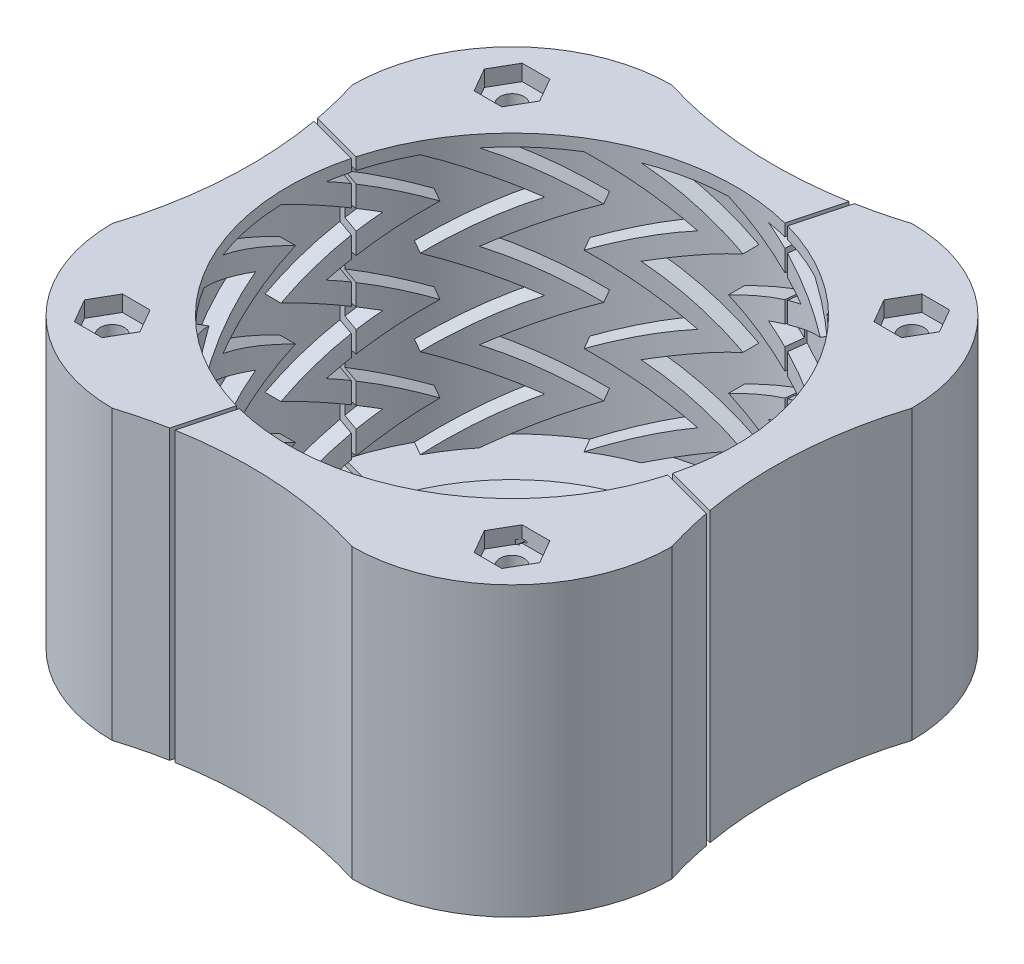
from build123d import *

# Parameters (mm, degrees)
SKETCH_2_W               = 70
SKETCH_2_H               = 70
EXTRUDE_1_DEPTH          = 36
FILLET_1_R               = 20
CUT_EXTRUDE_3_DEPTH      = 8
PATTERN_CIRCULAR_1_COUNT = 12
SKETCH_8_W               = 2
SKETCH_8_H               = 32.5
SKETCH_17_R              = 1.5
CUT_EXTRUDE_12_DEPTH     = 62.204574992
CUT_EXTRUDE_13_DEPTH     = 2
CUT_EXTRUDE_15_DEPTH     = 2
CUT_EXTRUDE_16_DEPTH     = 62.204574992
CUT_EXTRUDE_17_DEPTH     = 62.204574992


with BuildPart() as part:
    # Эскиз2 → Бобышка-Вытянуть1 (new body)
    with BuildSketch(Plane(origin=(0, 0, 0), x_dir=(1, 0, 0), z_dir=(0, 1, 0))):
        Rectangle(SKETCH_2_W, SKETCH_2_H)
    extrude(amount=EXTRUDE_1_DEPTH)

    # Эскиз3 → Вырез-Повернуть1 (revolve, cut)
    with BuildSketch(Plane(origin=(0, 0, 0), x_dir=(0, 0, -1), z_dir=(1, 0, 0))):
        Polygon((0, 36), (-28, 36), (-28, 2), (-23, 2), (-21, 0), (0, 0), align=None)
    revolve(axis=Axis((0, 0, 0), (0, 1, 0)), mode=Mode.SUBTRACT)

    # Скругление1
    fillet_1_edges = [part.edges().sort_by_distance(p)[0] for p in [
        (-35, 18, 35),
        (-35, 18, -35),
        (35, 18, -35),
        (35, 18, 35),
    ]]
    fillet(fillet_1_edges, radius=FILLET_1_R)

    # Эскиз7 → Вырез-Вытянуть3 (cut)
    with BuildSketch(Plane(origin=(23, 0, 0), x_dir=(0, 0, -1), z_dir=(1, 0, 0))):
        Polygon((10, 34.5), (0.899322945, 34.5), (-10, 29.166666667), (0.899322945, 23.833333333), (-10, 18.5), (0.899322945, 13.166666667), (-10, 7.833333333), (0.899322945, 2), (10, 2), (-0.899322945, 7.833333333), (10, 13.166666667), (-0.899322945, 18.5), (10, 23.833333333), (-0.899322945, 29.166666667), align=None)
    cut_extrude_3 = extrude(amount=CUT_EXTRUDE_3_DEPTH, mode=Mode.SUBTRACT)

    # Круговой массив1: Вырез-Вытянуть3 ×12 about axis
    pattern_circular_1_axis = Axis((0, 2, 0), (0, -1, 0))
    for i in range(1, PATTERN_CIRCULAR_1_COUNT):
        add(cut_extrude_3.rotate(pattern_circular_1_axis, i * 360 / PATTERN_CIRCULAR_1_COUNT), mode=Mode.SUBTRACT)

    # Эскиз8 → Повернуть1 (revolve)
    with BuildSketch(Plane(origin=(0, 0, 0), x_dir=(0, 0, -1), z_dir=(1, 0, 0))):
        with Locations((-31, 18.25)):
            Rectangle(SKETCH_8_W, SKETCH_8_H)
    revolve(axis=Axis((0, 47.507626588, 0), (0, -1, 0)))

    # Эскиз17 → Вырез-Вытянуть12 (cut, through all)
    with BuildSketch(Plane(origin=(0, 0, 0), x_dir=(1, 0, 0), z_dir=(0, 1, 0))):
        with Locations((-25, 25)):
            Circle(SKETCH_17_R)
        with Locations((25, 25)):
            Circle(SKETCH_17_R)
        with Locations((25, -25)):
            Circle(SKETCH_17_R)
        with Locations((-25, -25)):
            Circle(SKETCH_17_R)
    extrude(amount=CUT_EXTRUDE_12_DEPTH, mode=Mode.SUBTRACT)

    # Эскиз18 → Вырез-Вытянуть13 (cut)
    with BuildSketch(Plane(origin=(0, 36, 0), x_dir=(1, 0, 0), z_dir=(0, 1, 0))):
        Polygon((-26.732050808, 28), (-28.464101615, 25), (-26.732050808, 22), (-23.267949192, 22), (-21.535898385, 25), (-23.267949192, 28), align=None)
        Polygon((23.267949192, 28), (21.535898385, 25), (23.267949192, 22), (26.732050808, 22), (28.464101615, 25), (26.732050808, 28), align=None)
        Polygon((23.267949192, -22), (21.535898385, -25), (23.267949192, -28), (26.732050808, -28), (28.464101615, -25), (26.732050808, -22), align=None)
        Polygon((-26.732050808, -22), (-28.464101615, -25), (-26.732050808, -28), (-23.267949192, -28), (-21.535898385, -25), (-23.267949192, -22), align=None)
    extrude(amount=-CUT_EXTRUDE_13_DEPTH, mode=Mode.SUBTRACT)

    # Эскиз19 → Вырез-Вытянуть15 (cut)
    with BuildSketch(Plane(origin=(0, 0, 0), x_dir=(1, 0, 0), z_dir=(0, 1, 0))):
        Polygon((-26.732050808, -28), (-23.267949192, -28), (-21.535898385, -25), (-23.267949192, -22), (-26.732050808, -22), (-28.464101615, -25), align=None)
        Polygon((23.267949192, -28), (26.732050808, -28), (28.464101615, -25), (26.732050808, -22), (23.267949192, -22), (21.535898385, -25), align=None)
        Polygon((23.267949192, 22), (26.732050808, 22), (28.464101615, 25), (26.732050808, 28), (23.267949192, 28), (21.535898385, 25), align=None)
        Polygon((-26.732050808, 22), (-23.267949192, 22), (-21.535898385, 25), (-23.267949192, 28), (-26.732050808, 28), (-28.464101615, 25), align=None)
    extrude(amount=CUT_EXTRUDE_15_DEPTH, mode=Mode.SUBTRACT)

    # Эскиз20 → Вырез-Вытянуть16 (cut, through all)
    with BuildSketch(Plane(origin=(0, 0, 0), x_dir=(1, 0, 0), z_dir=(0, 1, 0))):
        Polygon((-0.176776695, 0.306186218), (-37.308912463, 10.25571201), (-37.438321986, 9.772749097), (-0.306186218, -0.176776695), align=None)
        Polygon((0, 0.965925826), (0, 0.258819045), (0.306186218, 0.176776695), (10.25571201, 37.308912463), (9.772749097, 37.438321986), align=None)
        Polygon((0, -0.258819045), (-0.306186218, -0.176776695), (-10.25571201, -37.308912463), (-9.772749097, -37.438321986), (0, -0.965925826), align=None)
        Polygon((37.438321986, -9.772749097), (0.306186218, 0.176776695), (0.176776695, -0.306186218), (37.308912463, -10.25571201), align=None)
    extrude(amount=CUT_EXTRUDE_16_DEPTH, mode=Mode.SUBTRACT)


with BuildPart() as cut_extrude_16_piece_1:
    # of the separate pieces the step leaves, piece 1, a body of its own (cut_extrude_16_pieces)
    add(part.part.solids().sort_by_distance((15, 0, 35))[0])


with BuildPart() as cut_extrude_16_piece_2:
    # of the separate pieces the step leaves, piece 2, a body of its own (cut_extrude_16_pieces)
    add(part.part.solids().sort_by_distance((5.19333333, 0, -20.347709673))[0])


with BuildPart() as cut_extrude_16_piece_3:
    # of the separate pieces the step leaves, piece 3, a body of its own (cut_extrude_16_pieces)
    add(part.part.solids().sort_by_distance((35, 0, -15))[0])


with BuildPart() as cut_extrude_16_piece_4:
    # of the separate pieces the step leaves, piece 4, a body of its own (cut_extrude_16_pieces)
    add(part.part.solids().sort_by_distance((-9.63704078, 0, 35))[0])


with BuildPart() as cut_extrude_17_tool:
    # Эскиз21 → Вырез-Вытянуть17 (new, through all)
    with BuildSketch(Plane(origin=(0, 0, 0), x_dir=(1, 0, 0), z_dir=(0, 1, 0))):
        with BuildLine():
            Line((34.336686882, 46.351507343), (-34.336686882, 46.351507343))
            ThreePointArc((-34.336686882, 46.351507343), (0, 32.696960071), (34.336686882, 46.351507343))
        make_face()
        with BuildLine():
            ThreePointArc((-46.351507343, -34.336686882), (-32.696960071, 0), (-46.351507343, 34.336686882))
            Line((-46.351507343, 34.336686882), (-46.351507343, -34.336686882))
        make_face()
        with BuildLine():
            ThreePointArc((46.351507343, 34.336686882), (32.696960071, 0), (46.351507343, -34.336686882))
            Line((46.351507343, -34.336686882), (46.351507343, 34.336686882))
        make_face()
        with BuildLine():
            ThreePointArc((34.336686882, -46.351507343), (0, -32.696960071), (-34.336686882, -46.351507343))
            Line((-34.336686882, -46.351507343), (34.336686882, -46.351507343))
        make_face()
    extrude(amount=CUT_EXTRUDE_17_DEPTH)


with BuildPart() as cut_extrude_16_piece_1_1:
    add(cut_extrude_16_piece_1.part)

    # Вырез-Вытянуть17: cut by cut_extrude_17_tool
    add(cut_extrude_17_tool.part, mode=Mode.SUBTRACT)


with BuildPart() as cut_extrude_16_piece_2_1:
    add(cut_extrude_16_piece_2.part)

    # Вырез-Вытянуть17: cut by cut_extrude_17_tool
    add(cut_extrude_17_tool.part, mode=Mode.SUBTRACT)


with BuildPart() as cut_extrude_16_piece_3_1:
    add(cut_extrude_16_piece_3.part)

    # Вырез-Вытянуть17: cut by cut_extrude_17_tool
    add(cut_extrude_17_tool.part, mode=Mode.SUBTRACT)


with BuildPart() as cut_extrude_16_piece_4_1:
    add(cut_extrude_16_piece_4.part)

    # Вырез-Вытянуть17: cut by cut_extrude_17_tool
    add(cut_extrude_17_tool.part, mode=Mode.SUBTRACT)


solid = Compound([cut_extrude_16_piece_1_1.part, cut_extrude_16_piece_2_1.part, cut_extrude_16_piece_3_1.part, cut_extrude_16_piece_4_1.part])
